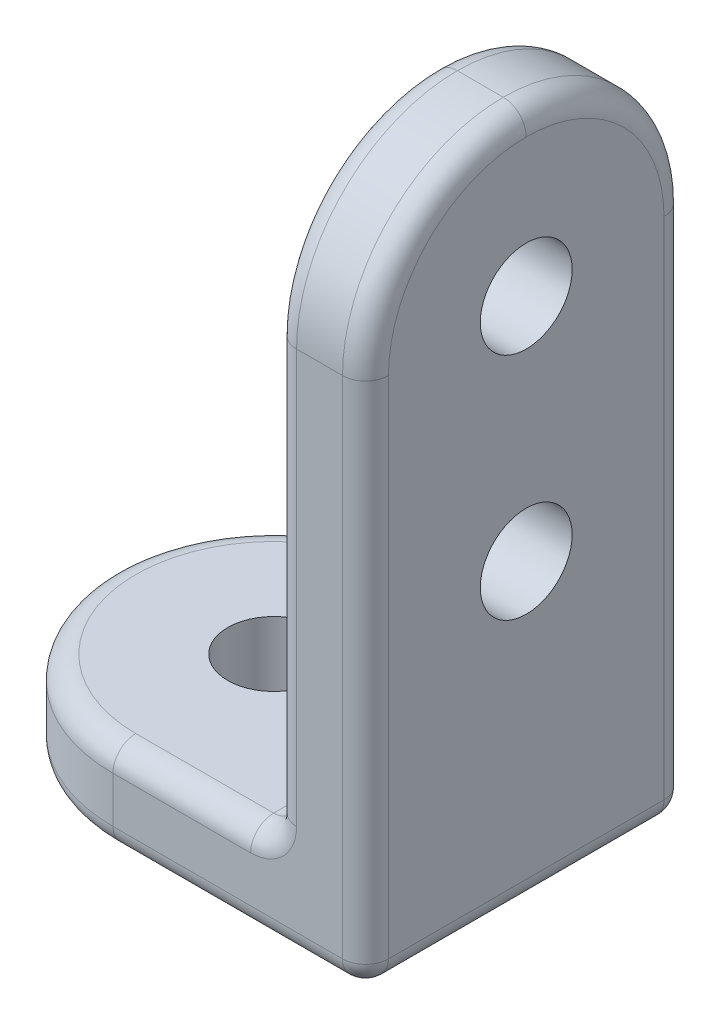
from build123d import *

# Parameters (mm, degrees)
SKETCH1_R           = 7
SKETCH1_R_2         = 2
BOSS_EXTRUDE1_DEPTH = 4
SKETCH2_W           = 4
SKETCH2_H           = 14
BOSS_EXTRUDE2_DEPTH = 26
CUT_EXTRUDE2_REACH  = 35.838
SKETCH4_R           = 2
FILLET6_R           = 7
FILLET7_R           = 1
FILLET8_R           = 1


with BuildPart() as part:
    # Sketch1 → Boss-Extrude1 (new body)
    # profile 1 of 2: a face of its own
    with BuildSketch(Plane(origin=(0, 0, 0), x_dir=(1, 0, 0), z_dir=(0, 1, 0))):
        Circle(SKETCH1_R)
        with Locations(Location((0, 0, 0), (0, 0, 270))):
            Circle(SKETCH1_R_2, mode=Mode.SUBTRACT)
    # profile 2 of 2: a face of its own
    with BuildSketch(Plane(origin=(0, 0, 0), x_dir=(1, 0, 0), z_dir=(0, 1, 0))):
        with BuildLine():
            Line((11, 7), (0, 7))
            ThreePointArc((0, 7), (4.949747468, 4.949747468), (7, 0))
            ThreePointArc((7, 0), (4.949747468, -4.949747468), (0, -7))
            Line((0, -7), (11, -7))
            Line((11, -7), (11, 7))
        make_face()
    extrude(amount=BOSS_EXTRUDE1_DEPTH)

    # Sketch2 → Boss-Extrude2 (add)
    with BuildSketch(Plane(origin=(0, 4, 0), x_dir=(1, 0, 0), z_dir=(0, 1, 0))):
        with Locations((9, 0)):
            Rectangle(SKETCH2_W, SKETCH2_H)
    extrude(amount=BOSS_EXTRUDE2_DEPTH)

    # Sketch4 → Cut-Extrude2 (cut, up to next)
    with BuildSketch(Plane.ZY.offset(-7), mode=Mode.PRIVATE) as cut_extrude2_sk1:
        with Locations((0, 23)):
            Circle(SKETCH4_R)
    cut_extrude2_tool1 = extrude(cut_extrude2_sk1.sketch, amount=-CUT_EXTRUDE2_REACH, mode=Mode.PRIVATE) & part.part
    # Sketch4 → Cut-Extrude2 (cut, up to next)
    with BuildSketch(Plane.ZY.offset(-7), mode=Mode.PRIVATE) as cut_extrude2_sk2:
        with Locations((0, 13)):
            Circle(SKETCH4_R)
    cut_extrude2_tool2 = extrude(cut_extrude2_sk2.sketch, amount=-CUT_EXTRUDE2_REACH, mode=Mode.PRIVATE) & part.part
    add(cut_extrude2_tool1.solids().sort_by_distance((7, 23, 0))[0], mode=Mode.SUBTRACT)
    add(cut_extrude2_tool2.solids().sort_by_distance((7, 13, 0))[0], mode=Mode.SUBTRACT)

    # Fillet6
    fillet6_edges = [part.edges().sort_by_distance(p)[0] for p in [
        (9, 30, -7),
        (9, 30, 7),
    ]]
    fillet(fillet6_edges, radius=FILLET6_R - 0.0001)  # a hair under: the kernel refuses the full size

    # Fillet7
    fillet7_edges = [part.edges().sort_by_distance(p)[0] for p in [
        (7, 4, 0),
        (11, 0, 0),
    ]]
    fillet(fillet7_edges, radius=FILLET7_R)

    # Fillet8
    fillet8_edges = [part.edges().sort_by_distance(p)[0] for p in [
        (3, 4, -7),
        (7, 14.00005, 7),
        (7, 14.00005, -7),
        (7, 27.949776758, 4.949776758),
        (7, 27.949776758, -4.949776758),
        (11, 12.00005, -7),
        (11, 12.00005, 7),
        (11, 27.949776758, 4.949776758),
        (11, 27.949776758, -4.949776758),
        (5, 0, 7),
        (3, 4, 7),
        (10.707106781, 0.292893219, 7),
        (10.707106781, 0.292893219, -7),
        (6.707106781, 4.292893219, 7),
        (6.707106781, 4.292893219, -7),
        (5, 0, -7),
        (-7, 0, 0),
        (-7, 4, 0),
    ]]
    fillet(fillet8_edges, radius=FILLET8_R)


solid = part.part
